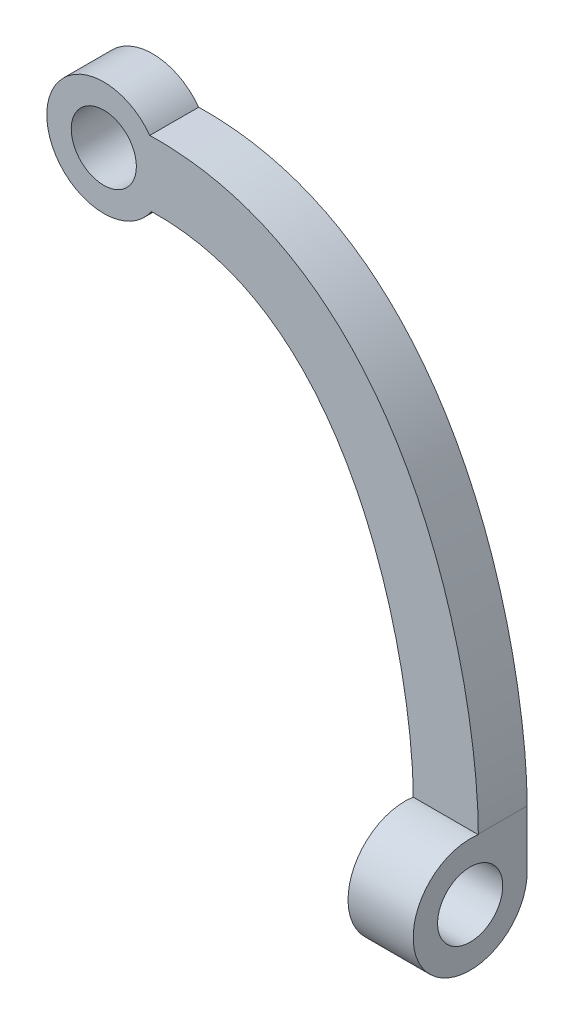
from build123d import *
from OCP.BRepAlgoAPI import BRepAlgoAPI_Cut
from OCP.TopTools import TopTools_ListOfShape

# Parameters (mm, degrees)
ESBO_O1_R                = 4
RESSALTO_EXTRUS_O1_DEPTH = 14
ESBO_O2_R                = 4
CORTE_EXTRUS_O1_DEPTH    = 85.267431587


with BuildPart() as part:
    # Esboço1 → Ressalto-extrusão1 (new body)
    with BuildSketch(Plane.XY):
        with BuildLine():
            Line((46, -7), (46, 6.995688759))
            add(Edge.make_bspline(
                [(5.650259544, 61.132138319), (6.660650147, 61.155575151), (8.710848107, 61.120789853), (12.578892548, 60.727605083), (17.127930578, 59.655790613), (22.040205616, 57.539349047), (26.394344624, 54.722364625), (30.19261077, 51.343572081), (34.558581899, 46.260896731), (38.815468688, 39.112541001), (41.760696394, 31.545459809), (43.470535674, 25.587286464), (44.459557745, 21.252306014), (45.183880004, 17.135758602), (45.589217997, 13.957943213), (45.8071763, 11.605329402), (45.920450747, 9.949575993), (45.986308659, 8.391657602), (46.000256085, 7.470883976), (46, 6.995688759)],
                knots=[0, 0, 0, 0, 0.03125, 0.0625, 0.125, 0.1875, 0.25, 0.3125, 0.375, 0.5, 0.625, 0.6875, 0.75, 0.8125, 0.875, 0.90625, 0.9375, 0.96875, 1, 1, 1, 1], degree=3))
            ThreePointArc((5.650259544, 61.132138319), (-6.998117599, 56.837672963), (5.835776158, 53.134289634))
            add(Edge.make_bspline(
                [(5.835776158, 53.134289634), (6.238188643, 53.143623919), (7.052270041, 53.146185942), (8.608930463, 53.086843267), (10.474039614, 52.897553491), (12.577068171, 52.49932445), (15.220765339, 51.755589596), (18.249448664, 50.451415), (21.515264324, 48.342822315), (24.453790354, 45.735335437), (27.957095233, 41.667286815), (31.567422767, 35.644835437), (34.179252288, 28.956801958), (35.718249768, 23.595597215), (36.614783762, 19.667281612), (37.272272941, 15.930397286), (37.638098577, 13.059067768), (37.83252613, 10.960084825), (37.932188748, 9.497611194), (37.979377076, 8.387903873), (37.997359238, 7.565341164), (38.000104404, 7.191578727), (38.000001162, 7)],
                knots=[0, 0, 0, 0, 0.015625, 0.03125, 0.0625, 0.09375, 0.125, 0.1875, 0.25, 0.3125, 0.375, 0.5, 0.625, 0.6875, 0.75, 0.8125, 0.875, 0.90625, 0.9375, 0.96875, 0.984375, 1, 1, 1, 1], degree=3))
            Line((38.000001162, 7), (38.000001162, -7))
            Line((38.000001162, -7), (46, -7))
        make_face()
        with Locations((0, 57)):
            Circle(ESBO_O1_R, mode=Mode.SUBTRACT)
    extrude(amount=RESSALTO_EXTRUS_O1_DEPTH)


with BuildPart() as corte_extrus_o1_tool:
    # Esboço2 → Corte-extrusão1 (new, through all)
    with BuildSketch(Plane(origin=(46, 0, 0), x_dir=(0, 0, -1), z_dir=(1, 0, 0))):
        with BuildLine():
            ThreePointArc((-7, -7), (-11.949747468, -4.949747468), (-14, 0))
            Line((-14, 0), (-14, -7))
            Line((-14, -7), (-7, -7))
        make_face()
        with BuildLine():
            Line((-7.245639543, 6.995688759), (-14, 6.995688759))
            Line((-14, 6.995688759), (-14, 0))
            ThreePointArc((-14, 0), (-12.035845351, 4.862125214), (-7.245639543, 6.995688759))
        make_face()
        with Locations((-7, 0)):
            Circle(ESBO_O2_R)
        with BuildLine():
            Line((0, -7), (0, 0))
            ThreePointArc((0, 0), (-2.050252532, -4.949747468), (-7, -7))
            Line((-7, -7), (0, -7))
        make_face()
        with BuildLine():
            Line((-6, 6.92820323), (-6, 6.995688759))
            Line((-6, 6.995688759), (-6.754360457, 6.995688759))
            ThreePointArc((-6.754360457, 6.995688759), (-6.37626685, 6.972155833), (-6, 6.92820323))
        make_face()
        with BuildLine():
            Line((-6, 6.995688759), (-6, 64))
            Line((-6, 64), (-14, 64))
            Line((-14, 64), (-14, 6.995688759))
            Line((-14, 6.995688759), (-7.245639543, 6.995688759))
            ThreePointArc((-7.245639543, 6.995688759), (-7, 7), (-6.754360457, 6.995688759))
            Line((-6.754360457, 6.995688759), (-6, 6.995688759))
        make_face()
    extrude(amount=-CORTE_EXTRUS_O1_DEPTH)


with BuildPart() as part_1:
    add(part.part)

    # Corte-extrusão1: cut by corte_extrus_o1_tool, with a tolerance
    corte_extrus_o1_stock = TopTools_ListOfShape()
    corte_extrus_o1_stock.Append(part_1.part.wrapped)
    corte_extrus_o1_tools = TopTools_ListOfShape()
    corte_extrus_o1_tools.Append(corte_extrus_o1_tool.part.wrapped)
    corte_extrus_o1_cut = BRepAlgoAPI_Cut()
    corte_extrus_o1_cut.SetArguments(corte_extrus_o1_stock)
    corte_extrus_o1_cut.SetTools(corte_extrus_o1_tools)
    corte_extrus_o1_cut.SetFuzzyValue(0.00001)
    corte_extrus_o1_cut.Build()
    add(Compound.cast(corte_extrus_o1_cut.Shape()).solids(), mode=Mode.REPLACE)


with BuildPart() as corte_extrus_o1_kept_piece:
    # of the separate pieces the step leaves, the one the design keeps (corte_extrus_o1_pieces_kept)
    add(part_1.part.solids().sort_by_distance((46, 0, 0))[0])


solid = corte_extrus_o1_kept_piece.part
